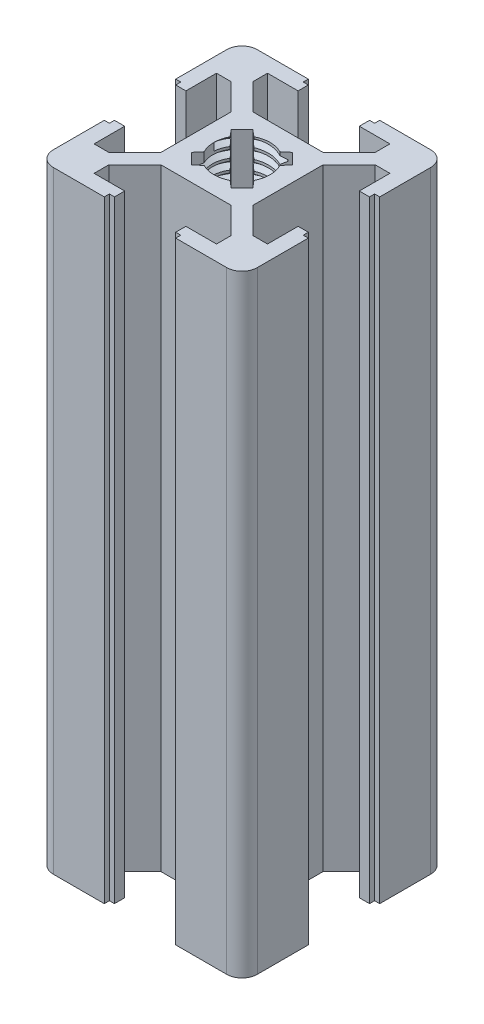
from build123d import *

# Parameters (mm, degrees)
DODANIE_WYCI_GNI_CIE1_DEPTH = 60
THREAD1_PITCH               = 1
THREAD2_PITCH               = 1


with BuildPart() as part:
    # Szkic1 → Dodanie-wyciągnięcie1 (new body)
    # profile 1 of 5: a face of its own
    with BuildSketch(Plane(origin=(0, 0, 0), x_dir=(1, 0, 0), z_dir=(0, 1, 0))):
        with BuildLine():
            Line((-7.06, 6), (-4.5, 3.440546933))
            Line((-4.5, 3.440546933), (-4.5, 4.5))
            Line((-4.5, 4.5), (-3.440546933, 4.5))
            Line((-3.440546933, 4.5), (-6, 7.06))
            Line((-6, 7.06), (-6, 8.5))
            Line((-6, 8.5), (-3, 8.5))
            Line((-3, 8.5), (-3, 9.5))
            Line((-3, 9.5), (-3.5, 9.5))
            Line((-3.5, 9.5), (-3.5, 10))
            Line((-3.5, 10), (-8.5, 10))
            ThreePointArc((-8.5, 10), (-9.560660172, 9.560660172), (-10, 8.5))
            Line((-10, 8.5), (-10, 3.5))
            Line((-10, 3.5), (-9.5, 3.5))
            Line((-9.5, 3.5), (-9.5, 3))
            Line((-9.5, 3), (-8.5, 3))
            Line((-8.5, 3), (-8.5, 6))
            Line((-8.5, 6), (-7.06, 6))
        make_face()
    # profile 2 of 5: a face of its own
    with BuildSketch(Plane(origin=(0, 0, 0), x_dir=(1, 0, 0), z_dir=(0, 1, 0))):
        with BuildLine():
            Line((4.5, 4.5), (4.5, 3.440546933))
            Line((4.5, 3.440546933), (7.06, 6))
            Line((7.06, 6), (8.5, 6))
            Line((8.5, 6), (8.5, 3))
            Line((8.5, 3), (9.5, 3))
            Line((9.5, 3), (9.5, 3.5))
            Line((9.5, 3.5), (10, 3.5))
            Line((10, 3.5), (10, 8.5))
            ThreePointArc((10, 8.5), (9.560660172, 9.560660172), (8.5, 10))
            Line((8.5, 10), (3.5, 10))
            Line((3.5, 10), (3.5, 9.5))
            Line((3.5, 9.5), (3, 9.5))
            Line((3, 9.5), (3, 8.5))
            Line((3, 8.5), (6, 8.5))
            Line((6, 8.5), (6, 7.06))
            Line((6, 7.06), (3.440546933, 4.5))
            Line((3.440546933, 4.5), (4.5, 4.5))
        make_face()
    # profile 3 of 5: a face of its own
    with BuildSketch(Plane(origin=(0, 0, 0), x_dir=(1, 0, 0), z_dir=(0, 1, 0))):
        Polygon((3.440546933, -4.5), (4.5, -4.5), (4.5, -3.440546933), (4.5, 3.440546933), (4.5, 4.5), (3.440546933, 4.5), (-3.440546933, 4.5), (-4.5, 4.5), (-4.5, 3.440546933), (-4.5, -3.440546933), (-4.5, -4.5), (-3.440546933, -4.5), align=None)
        with BuildLine():
            Line((-3.00520382, 1.944543648), (-1.944543648, 3.00520382))
            Line((-1.944543648, 3.00520382), (-1.271309214, 2.438498079))
            ThreePointArc((-1.271309214, 2.438498079), (0, 2.75), (1.271309214, 2.438498079))
            Line((1.271309214, 2.438498079), (1.944543648, 3.00520382))
            Line((1.944543648, 3.00520382), (3.00520382, 1.944543648))
            Line((3.00520382, 1.944543648), (2.438498079, 1.271309214))
            ThreePointArc((2.438498079, 1.271309214), (2.670989491, 0.654457899), (2.75, 0))
            ThreePointArc((2.75, 0), (2.670989491, -0.654457899), (2.438498079, -1.271309214))
            Line((2.438498079, -1.271309214), (3.00520382, -1.944543648))
            Line((3.00520382, -1.944543648), (1.944543648, -3.00520382))
            Line((1.944543648, -3.00520382), (1.271309214, -2.438498079))
            ThreePointArc((1.271309214, -2.438498079), (0, -2.75), (-1.271309214, -2.438498079))
            Line((-1.271309214, -2.438498079), (-1.944543648, -3.00520382))
            Line((-1.944543648, -3.00520382), (-3.00520382, -1.944543648))
            Line((-3.00520382, -1.944543648), (-2.438498079, -1.271309214))
            ThreePointArc((-2.438498079, -1.271309214), (-2.75, 0), (-2.438498079, 1.271309214))
            Line((-2.438498079, 1.271309214), (-3.00520382, 1.944543648))
        make_face(mode=Mode.SUBTRACT)
    # profile 4 of 5: a face of its own
    with BuildSketch(Plane(origin=(0, 0, 0), x_dir=(1, 0, 0), z_dir=(0, 1, 0))):
        with BuildLine():
            Line((-6, -7.06), (-3.440546933, -4.5))
            Line((-3.440546933, -4.5), (-4.5, -4.5))
            Line((-4.5, -4.5), (-4.5, -3.440546933))
            Line((-4.5, -3.440546933), (-7.06, -6))
            Line((-7.06, -6), (-8.5, -6))
            Line((-8.5, -6), (-8.5, -3))
            Line((-8.5, -3), (-9.5, -3))
            Line((-9.5, -3), (-9.5, -3.5))
            Line((-9.5, -3.5), (-10, -3.5))
            Line((-10, -3.5), (-10, -8.5))
            ThreePointArc((-10, -8.5), (-9.560660172, -9.560660172), (-8.5, -10))
            Line((-8.5, -10), (-3.5, -10))
            Line((-3.5, -10), (-3.5, -9.5))
            Line((-3.5, -9.5), (-3, -9.5))
            Line((-3, -9.5), (-3, -8.5))
            Line((-3, -8.5), (-6, -8.5))
            Line((-6, -8.5), (-6, -7.06))
        make_face()
    # profile 5 of 5: a face of its own
    with BuildSketch(Plane(origin=(0, 0, 0), x_dir=(1, 0, 0), z_dir=(0, 1, 0))):
        with BuildLine():
            Line((4.5, -3.440546933), (4.5, -4.5))
            Line((4.5, -4.5), (3.440546933, -4.5))
            Line((3.440546933, -4.5), (6, -7.06))
            Line((6, -7.06), (6, -8.5))
            Line((6, -8.5), (3, -8.5))
            Line((3, -8.5), (3, -9.5))
            Line((3, -9.5), (3.5, -9.5))
            Line((3.5, -9.5), (3.5, -10))
            Line((3.5, -10), (8.5, -10))
            ThreePointArc((8.5, -10), (9.560660172, -9.560660172), (10, -8.5))
            Line((10, -8.5), (10, -3.5))
            Line((10, -3.5), (9.5, -3.5))
            Line((9.5, -3.5), (9.5, -3))
            Line((9.5, -3), (8.5, -3))
            Line((8.5, -3), (8.5, -6))
            Line((8.5, -6), (7.06, -6))
            Line((7.06, -6), (4.5, -3.440546933))
        make_face()
    extrude(amount=DODANIE_WYCI_GNI_CIE1_DEPTH)

    # Thread1: the profile of Thread Profile1 profile screwed along a right-hand helix of 20 turns, 8 arcs to a turn; built about Z, then put on its axis
    thread1_z = Axis((0, 0, 0), (0, 0, 1))
    thread1_corners = [(2.7497, 0, -0.000173205), (3.291265875, 0, 0.312499999), (3.291265875, 0, 0.437499999), (2.7497, 0, 0.750173202)]
    with BuildLine(mode=Mode.PRIVATE) as thread1_profile:
        Line(thread1_corners[0], thread1_corners[1])
        Line(thread1_corners[1], thread1_corners[2])
        Line(thread1_corners[2], thread1_corners[3])
        Line(thread1_corners[3], thread1_corners[0])
    thread1_cap = Face(thread1_profile.wire())
    thread1_turn_angles = [0, 22.5, 45, 67.5, 90, 112.5, 135, 157.5, 180, 202.5, 225, 247.5, 270, 292.5, 315, 337.5, 360]
    thread1_turn_weights = [1, 0.9238795325112867, 1, 0.9238795325112867, 1, 0.9238795325112867, 1, 0.9238795325112867, 1, 0.9238795325112867, 1, 0.9238795325112867, 1, 0.9238795325112867, 1, 0.9238795325112867, 1]
    thread1_turn_rails = [Edge.make_bspline([Vector(p[0], p[1], 0).rotate(thread1_z, thread1_turn_angles[k]) / thread1_turn_weights[k] + Vector(0, 0, p[2] + THREAD1_PITCH * thread1_turn_angles[k] / 360) for k in range(17)], [0, 0, 0, 1, 1, 2, 2, 3, 3, 4, 4, 5, 5, 6, 6, 7, 7, 8, 8, 8], 2, thread1_turn_weights) for p in thread1_corners]
    thread1_turn_sides = [Face.make_surface_from_curves(thread1_turn_rails[p[0]], thread1_turn_rails[p[1]]) for p in [(0, 1), (1, 2), (2, 3), (3, 0)]]
    thread1 = Plane(origin=(0, 60, 0), x_dir=(-1, 0, 0), z_dir=(0, -1, 0)) * Solid(Shell([*[p.moved(Location((0, 0, THREAD1_PITCH * i))) for i in range(20) for p in thread1_turn_sides], thread1_cap, thread1_cap.rotate(thread1_z, 7200).moved(Location((0, 0, THREAD1_PITCH * 7200 / 360)))]))
    add(thread1, mode=Mode.SUBTRACT)

    # Thread2: the profile of Thread Profile2 profile screwed along a right-hand helix of 20 turns, 8 arcs to a turn; built about Z, then put on its axis
    thread2_z = Axis((0, 0, 0), (0, 0, 1))
    thread2_corners = [(2.7497, 0, -0.000173205), (3.291265875, 0, 0.312499999), (3.291265875, 0, 0.437499999), (2.7497, 0, 0.750173202)]
    with BuildLine(mode=Mode.PRIVATE) as thread2_profile:
        Line(thread2_corners[0], thread2_corners[1])
        Line(thread2_corners[1], thread2_corners[2])
        Line(thread2_corners[2], thread2_corners[3])
        Line(thread2_corners[3], thread2_corners[0])
    thread2_cap = Face(thread2_profile.wire())
    thread2_turn_angles = [0, 22.5, 45, 67.5, 90, 112.5, 135, 157.5, 180, 202.5, 225, 247.5, 270, 292.5, 315, 337.5, 360]
    thread2_turn_weights = [1, 0.9238795325112867, 1, 0.9238795325112867, 1, 0.9238795325112867, 1, 0.9238795325112867, 1, 0.9238795325112867, 1, 0.9238795325112867, 1, 0.9238795325112867, 1, 0.9238795325112867, 1]
    thread2_turn_rails = [Edge.make_bspline([Vector(p[0], p[1], 0).rotate(thread2_z, thread2_turn_angles[k]) / thread2_turn_weights[k] + Vector(0, 0, p[2] + THREAD2_PITCH * thread2_turn_angles[k] / 360) for k in range(17)], [0, 0, 0, 1, 1, 2, 2, 3, 3, 4, 4, 5, 5, 6, 6, 7, 7, 8, 8, 8], 2, thread2_turn_weights) for p in thread2_corners]
    thread2_turn_sides = [Face.make_surface_from_curves(thread2_turn_rails[p[0]], thread2_turn_rails[p[1]]) for p in [(0, 1), (1, 2), (2, 3), (3, 0)]]
    thread2 = Plane(origin=(0, 0, 0), x_dir=(1, 0, 0), z_dir=(0, 1, 0)) * Solid(Shell([*[p.moved(Location((0, 0, THREAD2_PITCH * i))) for i in range(20) for p in thread2_turn_sides], thread2_cap, thread2_cap.rotate(thread2_z, 7200).moved(Location((0, 0, THREAD2_PITCH * 7200 / 360)))]))
    add(thread2, mode=Mode.SUBTRACT)


solid = part.part
